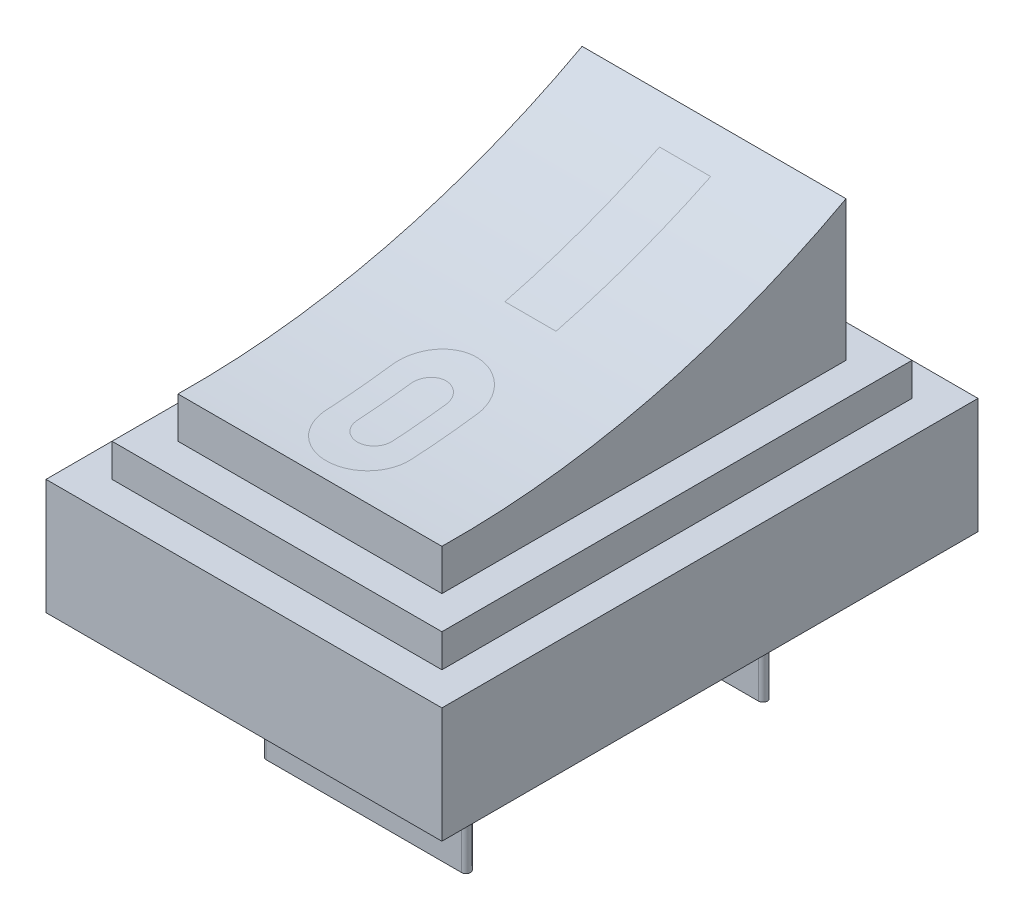
from build123d import *

# Parameters (mm, degrees)
BOSS_EXTRUDE1_DEPTH = 4
SKETCH4_W           = 10
SKETCH4_H           = 14.25
BOSS_EXTRUDE3_DEPTH = 1
SKETCH5_W           = 12
SKETCH5_H           = 16.25
BOSS_EXTRUDE4_DEPTH = 3.5
BOSS_EXTRUDE5_DEPTH = 4
SKETCH9_R           = 0.75
CUT_EXTRUDE1_DEPTH  = 15


with BuildPart() as part:
    # Sketch3 → Boss-Extrude1 (new, symmetric)
    with BuildSketch(Plane(origin=(0, 0, 0), x_dir=(0, 0, -1), z_dir=(1, 0, 0))):
        with BuildLine():
            Line((12.25, 0), (12.25, 3))
            ThreePointArc((12.25, 3), (6.317288831, 0.714820607), (0, 0))
            Line((0, 0), (0, -1.241610738))
            Line((0, -1.241610738), (12.25, -1.241610738))
            Line((12.25, -1.241610738), (12.25, 0))
        make_face()
    extrude(amount=BOSS_EXTRUDE1_DEPTH, both=True)

    # Sketch4 → Boss-Extrude3 (add)
    with BuildSketch(Plane.XZ.offset(1.241610738)):
        with Locations((0, -6.125)):
            Rectangle(SKETCH4_W, SKETCH4_H)
    extrude(amount=BOSS_EXTRUDE3_DEPTH)

    # Sketch5 → Boss-Extrude4 (add)
    with BuildSketch(Plane.XZ.offset(2.241610738)):
        with Locations((0, -6.125)):
            Rectangle(SKETCH5_W, SKETCH5_H)
    extrude(amount=BOSS_EXTRUDE4_DEPTH)

    # Sketch7 → Boss-Extrude5 (add)
    with BuildSketch(Plane(origin=(0, -5.741610738, 0), x_dir=(-1, 0, 0), z_dir=(0, -1, 0))):
        with BuildLine():
            Line((2.803468906, 1.475504884), (-3.123211629, 1.475504884))
            ThreePointArc((-3.123211629, 1.475504884), (-3.25683891, 1.609132165), (-3.123211629, 1.742759447))
            Line((-3.123211629, 1.742759447), (2.803468906, 1.742759447))
            ThreePointArc((2.803468906, 1.742759447), (2.937096188, 1.609132165), (2.803468906, 1.475504884))
        make_face()
        with BuildLine():
            Line((2.803468906, 10.475504884), (-3.123211629, 10.475504884))
            ThreePointArc((-3.123211629, 10.475504884), (-3.25683891, 10.609132165), (-3.123211629, 10.742759447))
            Line((-3.123211629, 10.742759447), (2.803468906, 10.742759447))
            ThreePointArc((2.803468906, 10.742759447), (2.937096188, 10.609132165), (2.803468906, 10.475504884))
        make_face()
    extrude(amount=BOSS_EXTRUDE5_DEPTH)

    # Sketch9 → Cut-Extrude1 (cut)
    with BuildSketch(Plane(origin=(0, 0, -10.742759447), x_dir=(-1, 0, 0), z_dir=(0, 0, -1))):
        with Locations((0, -7.783404694)):
            Circle(SKETCH9_R)
    extrude(amount=-CUT_EXTRUDE1_DEPTH, mode=Mode.SUBTRACT)


solid = part.part
